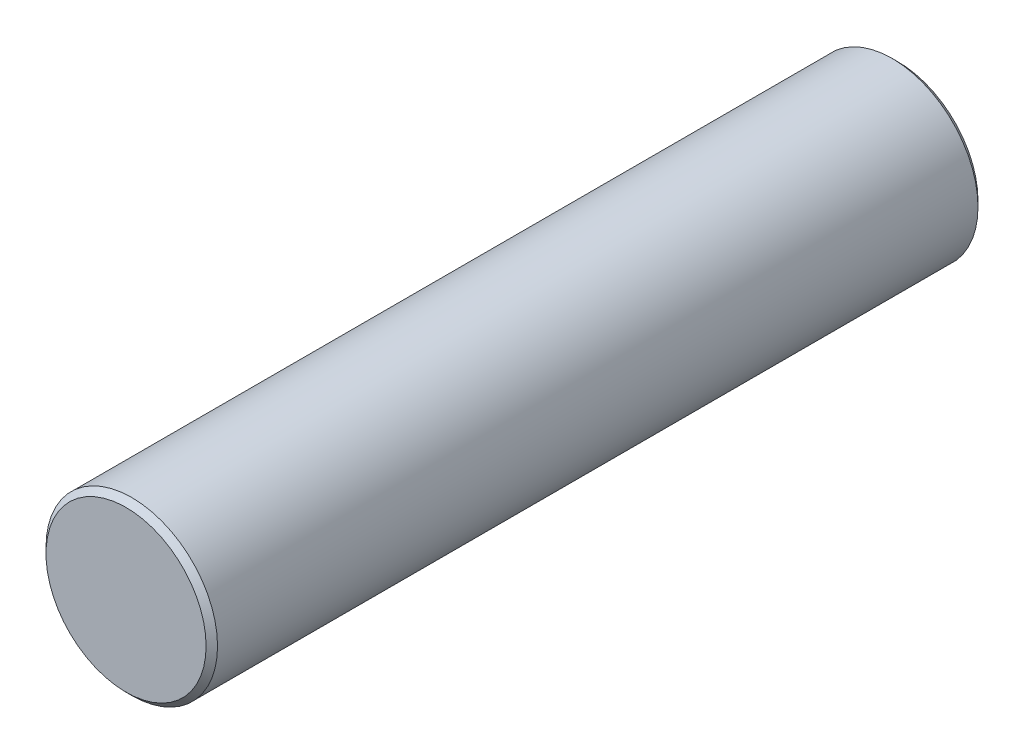
from build123d import *

# Parameters (mm, degrees)
SKETCH1_R           = 30
BOSS_EXTRUDE1_DEPTH = 270
CHAMFER1_SIZE       = 2
SKETCH2_R           = 5
CUT_EXTRUDE1_DEPTH  = 30
THREAD1_PITCH       = 1.5


with BuildPart() as part:
    # Sketch1 → Boss-Extrude1 (new body)
    with BuildSketch(Plane.XY):
        Circle(SKETCH1_R)
    extrude(amount=BOSS_EXTRUDE1_DEPTH)

    # Chamfer1
    chamfer1_edges = [part.edges().sort_by_distance(p)[0] for p in [
        (-30, 0, 0),
        (-30, 0, 270),
    ]]
    chamfer(chamfer1_edges, length=CHAMFER1_SIZE)

    # Sketch2 → Cut-Extrude1 (cut)
    with BuildSketch(Plane(origin=(0, 0, 0), x_dir=(-1, 0, 0), z_dir=(0, 0, -1))):
        Circle(SKETCH2_R)
    extrude(amount=-CUT_EXTRUDE1_DEPTH, mode=Mode.SUBTRACT)

    # Thread1: the profile of Thread Profile1 profile screwed along a right-hand helix of 20 turns, 8 arcs to a turn; built about Z, then put on its axis
    thread1_z = Axis((0, 0, 0), (0, 0, 1))
    thread1_corners = [(5.0003, 0, 1.12517321), (4.18810118, 0, 0.656250002), (4.18810118, 0, 0.468750002), (5.0003, 0, -0.000173205)]
    with BuildLine(mode=Mode.PRIVATE) as thread1_profile:
        Line(thread1_corners[0], thread1_corners[1])
        Line(thread1_corners[1], thread1_corners[2])
        Line(thread1_corners[2], thread1_corners[3])
        Line(thread1_corners[3], thread1_corners[0])
    thread1_cap = Face(thread1_profile.wire())
    thread1_turn_angles = [0, 22.5, 45, 67.5, 90, 112.5, 135, 157.5, 180, 202.5, 225, 247.5, 270, 292.5, 315, 337.5, 360]
    thread1_turn_weights = [1, 0.9238795325112867, 1, 0.9238795325112867, 1, 0.9238795325112867, 1, 0.9238795325112867, 1, 0.9238795325112867, 1, 0.9238795325112867, 1, 0.9238795325112867, 1, 0.9238795325112867, 1]
    thread1_turn_rails = [Edge.make_bspline([Vector(p[0], p[1], 0).rotate(thread1_z, thread1_turn_angles[k]) / thread1_turn_weights[k] + Vector(0, 0, p[2] + THREAD1_PITCH * thread1_turn_angles[k] / 360) for k in range(17)], [0, 0, 0, 1, 1, 2, 2, 3, 3, 4, 4, 5, 5, 6, 6, 7, 7, 8, 8, 8], 2, thread1_turn_weights) for p in thread1_corners]
    thread1_turn_sides = [Face.make_surface_from_curves(thread1_turn_rails[p[0]], thread1_turn_rails[p[1]]) for p in [(0, 1), (1, 2), (2, 3), (3, 0)]]
    thread1 = Plane(origin=(0, 0, 0), x_dir=(1, 0, 0), z_dir=(0, 0, 1)) * Solid(Shell([*[p.moved(Location((0, 0, THREAD1_PITCH * i))) for i in range(20) for p in thread1_turn_sides], thread1_cap, thread1_cap.rotate(thread1_z, 7200).moved(Location((0, 0, THREAD1_PITCH * 7200 / 360)))]))
    add(thread1)


solid = part.part
